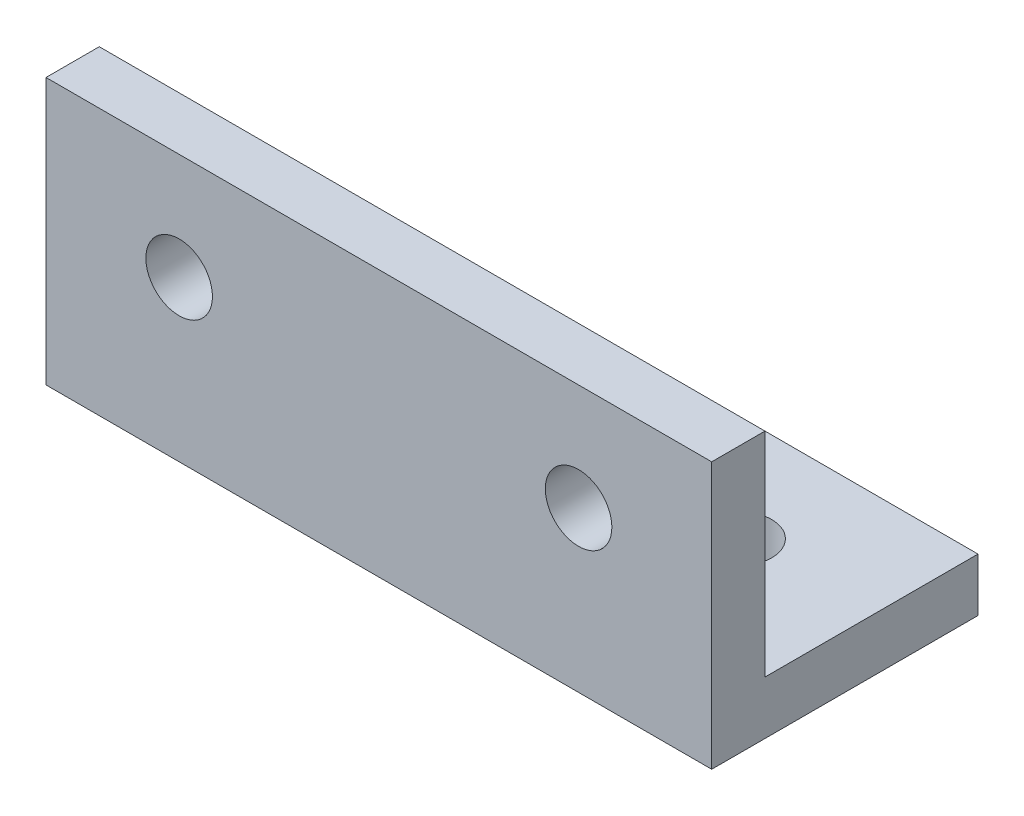
from build123d import *

# Parameters (mm, degrees)
SKETCH_1_W          = 50
SKETCH_1_H          = 20
SKETCH_1_R          = 2.5
EXTRUDE_1_DEPTH     = 4
SKETCH_2_W          = 50
SKETCH_2_H          = 4
EXTRUDE_2_DEPTH     = 16
SKETCH_3_R          = 2.5
CUT_EXTRUDE_1_DEPTH = 4


with BuildPart() as part:
    # Эскиз1 → Бобышка-Вытянуть1 (new body)
    with BuildSketch(Plane(origin=(0, 0, 0), x_dir=(1, 0, 0), z_dir=(0, 1, 0))):
        with Locations((25, 10)):
            Rectangle(SKETCH_1_W, SKETCH_1_H)
        with Locations((10, 12)):
            Circle(SKETCH_1_R, mode=Mode.SUBTRACT)
        with Locations((40, 12)):
            Circle(SKETCH_1_R, mode=Mode.SUBTRACT)
    extrude(amount=EXTRUDE_1_DEPTH)

    # Эскиз2 → Бобышка-Вытянуть2 (add)
    with BuildSketch(Plane(origin=(0, 4, 0), x_dir=(1, 0, 0), z_dir=(0, 1, 0))):
        with Locations((25, 2)):
            Rectangle(SKETCH_2_W, SKETCH_2_H)
    extrude(amount=EXTRUDE_2_DEPTH)

    # Эскиз3 → Вырез-Вытянуть1 (cut)
    with BuildSketch(Plane.XY):
        with Locations((10, 12)):
            Circle(SKETCH_3_R)
        with Locations((40, 12)):
            Circle(SKETCH_3_R)
    extrude(amount=-CUT_EXTRUDE_1_DEPTH, mode=Mode.SUBTRACT)


solid = part.part
